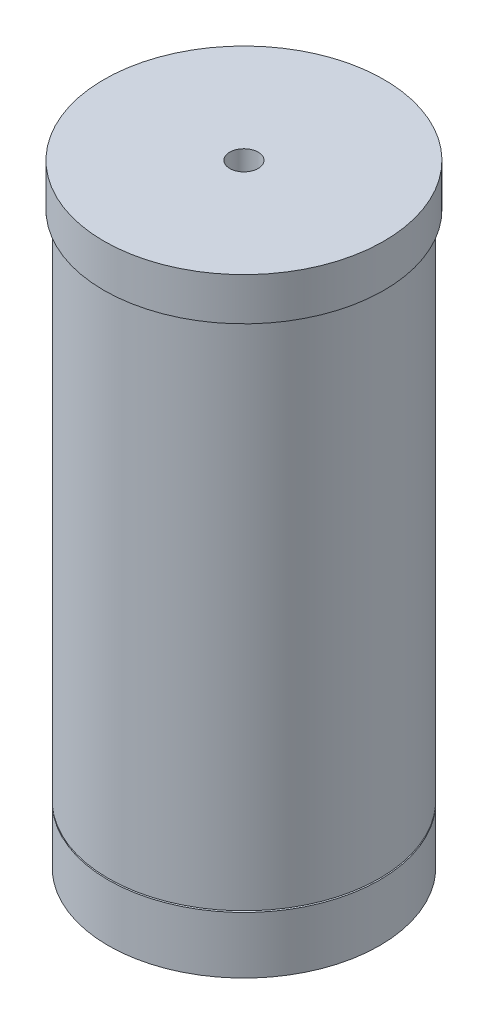
from build123d import *

# Parameters (mm, degrees)
SKETCH1_R             = 47.75
SKETCH1_R_2           = 11.5
SKETCH1_R_3           = 5
SKETCH1_R_4           = 8.5
SKETCH1_R_5           = 6
BOSS_EXTRUDE1_DEPTH   = 45
SKETCH1_3_R           = 11.5
SKETCH1_3_R_2         = 8.5
CUT_EXTRUDE1_DEPTH    = 5
SKETCH3_R             = 47.75
SKETCH3_R_2           = 5
BOSS_EXTRUDE2_DEPTH   = 10
BOSS_EXTRUDE6_DEPTH   = 125
SKETCH6_R             = 47.75
SKETCH6_R_2           = 42.5
BOSS_EXTRUDE6_2_DEPTH = 125
BOSS_EXTRUDE7_DEPTH   = 20
SKETCH7_R             = 11.25
SKETCH7_R_2           = 8.75
BOSS_EXTRUDE8_DEPTH   = 2
BOSS_EXTRUDE8_2_DEPTH = 2
BOSS_EXTRUDE8_3_DEPTH = 2
BOSS_EXTRUDE8_4_DEPTH = 2
BOSS_EXTRUDE8_5_DEPTH = 2
BOSS_EXTRUDE8_6_DEPTH = 2
BOSS_EXTRUDE9_START   = -20
SKETCH7_4_R           = 47.75
BOSS_EXTRUDE9_DEPTH   = 20
SKETCH8_R             = 49.28
SKETCH8_R_2           = 5
BOSS_EXTRUDE10_DEPTH  = 15
BOSS_EXTRUDE11_START  = -25
SKETCH8_4_R           = 5
BOSS_EXTRUDE11_DEPTH  = 25


with BuildPart() as part:
    # Sketch1 → Boss-Extrude1 (new body)
    # profile 1 of 13: a face of its own
    with BuildSketch(Plane(origin=(0, 0, 0), x_dir=(1, 0, 0), z_dir=(0, 1, 0))):
        Circle(SKETCH1_R)
        with Locations((-31.875552268, -8.541028488)):
            Circle(SKETCH1_R_2, mode=Mode.SUBTRACT)
        with Locations((-8.541028488, -31.875552268)):
            Circle(SKETCH1_R_2, mode=Mode.SUBTRACT)
        with Locations((23.334523779, -23.334523779)):
            Circle(SKETCH1_R_2, mode=Mode.SUBTRACT)
        with Locations((31.875552268, 8.541028488)):
            Circle(SKETCH1_R_2, mode=Mode.SUBTRACT)
        with Locations((8.541028488, 31.875552268)):
            Circle(SKETCH1_R_2, mode=Mode.SUBTRACT)
        with Locations((-23.334523779, 23.334523779)):
            Circle(SKETCH1_R_2, mode=Mode.SUBTRACT)
        Circle(SKETCH1_R_3, mode=Mode.SUBTRACT)
    # profile 2 of 13: a face of its own
    with BuildSketch(Plane(origin=(0, 0, 0), x_dir=(1, 0, 0), z_dir=(0, 1, 0))):
        with Locations((23.334523779, -23.334523779)):
            Circle(SKETCH1_R_2)
        with Locations((23.334523779, -23.334523779)):
            Circle(SKETCH1_R_4, mode=Mode.SUBTRACT)
    # profile 3 of 13: a face of its own
    with BuildSketch(Plane(origin=(0, 0, 0), x_dir=(1, 0, 0), z_dir=(0, 1, 0))):
        with Locations((23.334523779, -23.334523779)):
            Circle(SKETCH1_R_4)
        with Locations((23.334523779, -23.334523779)):
            Circle(SKETCH1_R_5, mode=Mode.SUBTRACT)
    # profile 4 of 13: a face of its own
    with BuildSketch(Plane(origin=(0, 0, 0), x_dir=(1, 0, 0), z_dir=(0, 1, 0))):
        with Locations((31.875552268, 8.541028488)):
            Circle(SKETCH1_R_2)
        with Locations((31.875552268, 8.541028488)):
            Circle(SKETCH1_R_4, mode=Mode.SUBTRACT)
    # profile 5 of 13: a face of its own
    with BuildSketch(Plane(origin=(0, 0, 0), x_dir=(1, 0, 0), z_dir=(0, 1, 0))):
        with Locations((31.875552268, 8.541028488)):
            Circle(SKETCH1_R_4)
        with Locations((31.875552268, 8.541028488)):
            Circle(SKETCH1_R_5, mode=Mode.SUBTRACT)
    # profile 6 of 13: a face of its own
    with BuildSketch(Plane(origin=(0, 0, 0), x_dir=(1, 0, 0), z_dir=(0, 1, 0))):
        with Locations((-8.541028488, -31.875552268)):
            Circle(SKETCH1_R_2)
        with Locations((-8.541028488, -31.875552268)):
            Circle(SKETCH1_R_4, mode=Mode.SUBTRACT)
    # profile 7 of 13: a face of its own
    with BuildSketch(Plane(origin=(0, 0, 0), x_dir=(1, 0, 0), z_dir=(0, 1, 0))):
        with Locations((-8.541028488, -31.875552268)):
            Circle(SKETCH1_R_4)
        with Locations((-8.541028488, -31.875552268)):
            Circle(SKETCH1_R_5, mode=Mode.SUBTRACT)
    # profile 8 of 13: a face of its own
    with BuildSketch(Plane(origin=(0, 0, 0), x_dir=(1, 0, 0), z_dir=(0, 1, 0))):
        with Locations((-31.875552268, -8.541028488)):
            Circle(SKETCH1_R_2)
        with Locations((-31.875552268, -8.541028488)):
            Circle(SKETCH1_R_4, mode=Mode.SUBTRACT)
    # profile 9 of 13: a face of its own
    with BuildSketch(Plane(origin=(0, 0, 0), x_dir=(1, 0, 0), z_dir=(0, 1, 0))):
        with Locations((-31.875552268, -8.541028488)):
            Circle(SKETCH1_R_4)
        with Locations((-31.875552268, -8.541028488)):
            Circle(SKETCH1_R_5, mode=Mode.SUBTRACT)
    # profile 10 of 13: a face of its own
    with BuildSketch(Plane(origin=(0, 0, 0), x_dir=(1, 0, 0), z_dir=(0, 1, 0))):
        with Locations((-23.334523779, 23.334523779)):
            Circle(SKETCH1_R_2)
        with Locations((-23.334523779, 23.334523779)):
            Circle(SKETCH1_R_4, mode=Mode.SUBTRACT)
    # profile 11 of 13: a face of its own
    with BuildSketch(Plane(origin=(0, 0, 0), x_dir=(1, 0, 0), z_dir=(0, 1, 0))):
        with Locations((-23.334523779, 23.334523779)):
            Circle(SKETCH1_R_4)
        with Locations((-23.334523779, 23.334523779)):
            Circle(SKETCH1_R_5, mode=Mode.SUBTRACT)
    # profile 12 of 13: a face of its own
    with BuildSketch(Plane(origin=(0, 0, 0), x_dir=(1, 0, 0), z_dir=(0, 1, 0))):
        with Locations((8.541028488, 31.875552268)):
            Circle(SKETCH1_R_2)
        with Locations((8.541028488, 31.875552268)):
            Circle(SKETCH1_R_4, mode=Mode.SUBTRACT)
    # profile 13 of 13: a face of its own
    with BuildSketch(Plane(origin=(0, 0, 0), x_dir=(1, 0, 0), z_dir=(0, 1, 0))):
        with Locations((8.541028488, 31.875552268)):
            Circle(SKETCH1_R_4)
        with Locations((8.541028488, 31.875552268)):
            Circle(SKETCH1_R_5, mode=Mode.SUBTRACT)
    extrude(amount=BOSS_EXTRUDE1_DEPTH)

    # Sketch1<3> → Cut-Extrude1 (cut)
    # profile 1 of 6: a face of its own
    with BuildSketch(Plane(origin=(0, 0, 0), x_dir=(1, 0, 0), z_dir=(0, 1, 0))):
        with Locations((-8.541028488, -31.875552268)):
            Circle(SKETCH1_3_R)
        with Locations((-8.541028488, -31.875552268)):
            Circle(SKETCH1_3_R_2, mode=Mode.SUBTRACT)
    # profile 2 of 6: a face of its own
    with BuildSketch(Plane(origin=(0, 0, 0), x_dir=(1, 0, 0), z_dir=(0, 1, 0))):
        with Locations((-31.875552268, -8.541028488)):
            Circle(SKETCH1_3_R)
        with Locations((-31.875552268, -8.541028488)):
            Circle(SKETCH1_3_R_2, mode=Mode.SUBTRACT)
    # profile 3 of 6: a face of its own
    with BuildSketch(Plane(origin=(0, 0, 0), x_dir=(1, 0, 0), z_dir=(0, 1, 0))):
        with Locations((-23.334523779, 23.334523779)):
            Circle(SKETCH1_3_R)
        with Locations((-23.334523779, 23.334523779)):
            Circle(SKETCH1_3_R_2, mode=Mode.SUBTRACT)
    # profile 4 of 6: a face of its own
    with BuildSketch(Plane(origin=(0, 0, 0), x_dir=(1, 0, 0), z_dir=(0, 1, 0))):
        with Locations((8.541028488, 31.875552268)):
            Circle(SKETCH1_3_R)
        with Locations((8.541028488, 31.875552268)):
            Circle(SKETCH1_3_R_2, mode=Mode.SUBTRACT)
    # profile 5 of 6: a face of its own
    with BuildSketch(Plane(origin=(0, 0, 0), x_dir=(1, 0, 0), z_dir=(0, 1, 0))):
        with Locations((31.875552268, 8.541028488)):
            Circle(SKETCH1_3_R)
        with Locations((31.875552268, 8.541028488)):
            Circle(SKETCH1_3_R_2, mode=Mode.SUBTRACT)
    # profile 6 of 6: a face of its own
    with BuildSketch(Plane(origin=(0, 0, 0), x_dir=(1, 0, 0), z_dir=(0, 1, 0))):
        with Locations((23.334523779, -23.334523779)):
            Circle(SKETCH1_3_R)
        with Locations((23.334523779, -23.334523779)):
            Circle(SKETCH1_3_R_2, mode=Mode.SUBTRACT)
    extrude(amount=CUT_EXTRUDE1_DEPTH, mode=Mode.SUBTRACT)

    # Sketch3 → Boss-Extrude2 (add)
    with BuildSketch(Plane(origin=(0, 45, 0), x_dir=(1, 0, 0), z_dir=(0, 1, 0))):
        Circle(SKETCH3_R)
        Circle(SKETCH3_R_2, mode=Mode.SUBTRACT)
    extrude(amount=BOSS_EXTRUDE2_DEPTH)


with BuildPart() as body_2:
    # Sketch6 → Boss-Extrude6 (new body)
    with BuildSketch(Plane(origin=(0, 55, 0), x_dir=(1, 0, 0), z_dir=(0, 1, 0))):
        with BuildLine():
            ThreePointArc((15, 39.497626511), (0, 42.25), (-15, 39.497626511))
            Line((-15, 39.497626511), (-15, -39.497626511))
            ThreePointArc((-15, -39.497626511), (0, -42.25), (15, -39.497626511))
            Line((15, -39.497626511), (15, 39.497626511))
        make_face()
        with BuildLine():
            Line((-10, -34.497626511), (-10, 34.497626511))
            ThreePointArc((-10, 34.497626511), (0, 35.917770461), (10, 34.497626511))
            Line((10, 34.497626511), (10, -34.497626511))
            ThreePointArc((10, -34.497626511), (0, -35.917770461), (-10, -34.497626511))
        make_face(mode=Mode.SUBTRACT)
    extrude(amount=BOSS_EXTRUDE6_DEPTH)


with BuildPart() as body_3:
    # Sketch6 → Boss-Extrude6 2 (new body)
    with BuildSketch(Plane(origin=(0, 55, 0), x_dir=(1, 0, 0), z_dir=(0, 1, 0))):
        Circle(SKETCH6_R)
        Circle(SKETCH6_R_2, mode=Mode.SUBTRACT)
    extrude(amount=BOSS_EXTRUDE6_2_DEPTH)


with BuildPart() as body_4:
    # Sketch6<4> → Boss-Extrude7 (new body)
    with BuildSketch(Plane(origin=(0, 55, 0), x_dir=(1, 0, 0), z_dir=(0, 1, 0))):
        with BuildLine():
            ThreePointArc((9.5, 33.997626511), (0, 35.299980289), (-9.5, 33.997626511))
            Line((-9.5, 33.997626511), (-9.5, -33.997626511))
            ThreePointArc((-9.5, -33.997626511), (0, -35.299980289), (9.5, -33.997626511))
            Line((9.5, -33.997626511), (9.5, 33.997626511))
        make_face()
        with BuildLine():
            Line((-5.5, -30.812964253), (-5.5, 30.812964253))
            ThreePointArc((-5.5, 30.812964253), (0, 31.299980289), (5.5, 30.812964253))
            Line((5.5, 30.812964253), (5.5, -30.812964253))
            ThreePointArc((5.5, -30.812964253), (0, -31.299980289), (-5.5, -30.812964253))
        make_face(mode=Mode.SUBTRACT)
    extrude(amount=BOSS_EXTRUDE7_DEPTH)


with BuildPart() as body_5:
    # Sketch7 → Boss-Extrude8 (new body)
    with BuildSketch(Plane(origin=(0, -0.5, 0), x_dir=(1, 0, 0), z_dir=(0, 1, 0))):
        with Locations((-8.541028488, -31.875552268)):
            Circle(SKETCH7_R)
        with Locations((-8.541028488, -31.875552268)):
            Circle(SKETCH7_R_2, mode=Mode.SUBTRACT)
    extrude(amount=BOSS_EXTRUDE8_DEPTH)

    # Sketch7<4> → Boss-Extrude9 (add)
    with BuildSketch(Plane(origin=(0, -0.5, 0), x_dir=(1, 0, 0), z_dir=(0, 1, 0)).offset(BOSS_EXTRUDE9_START)):
        Circle(SKETCH7_4_R)
    extrude(amount=BOSS_EXTRUDE9_DEPTH)


with BuildPart() as body_6:
    # Sketch7 → Boss-Extrude8 2 (new body)
    with BuildSketch(Plane(origin=(0, -0.5, 0), x_dir=(1, 0, 0), z_dir=(0, 1, 0))):
        with Locations((-31.875552268, -8.541028488)):
            Circle(SKETCH7_R)
        with Locations((-31.875552268, -8.541028488)):
            Circle(SKETCH7_R_2, mode=Mode.SUBTRACT)
    extrude(amount=BOSS_EXTRUDE8_2_DEPTH)


with BuildPart() as body_7:
    # Sketch7 → Boss-Extrude8 3 (new body)
    with BuildSketch(Plane(origin=(0, -0.5, 0), x_dir=(1, 0, 0), z_dir=(0, 1, 0))):
        with Locations((-23.334523779, 23.334523779)):
            Circle(SKETCH7_R)
        with Locations((-23.334523779, 23.334523779)):
            Circle(SKETCH7_R_2, mode=Mode.SUBTRACT)
    extrude(amount=BOSS_EXTRUDE8_3_DEPTH)


with BuildPart() as body_8:
    # Sketch7 → Boss-Extrude8 4 (new body)
    with BuildSketch(Plane(origin=(0, -0.5, 0), x_dir=(1, 0, 0), z_dir=(0, 1, 0))):
        with Locations((23.334523779, -23.334523779)):
            Circle(SKETCH7_R)
        with Locations((23.334523779, -23.334523779)):
            Circle(SKETCH7_R_2, mode=Mode.SUBTRACT)
    extrude(amount=BOSS_EXTRUDE8_4_DEPTH)


with BuildPart() as body_9:
    # Sketch7 → Boss-Extrude8 5 (new body)
    with BuildSketch(Plane(origin=(0, -0.5, 0), x_dir=(1, 0, 0), z_dir=(0, 1, 0))):
        with Locations((8.541028488, 31.875552268)):
            Circle(SKETCH7_R)
        with Locations((8.541028488, 31.875552268)):
            Circle(SKETCH7_R_2, mode=Mode.SUBTRACT)
    extrude(amount=BOSS_EXTRUDE8_5_DEPTH)


with BuildPart() as body_10:
    # Sketch7 → Boss-Extrude8 6 (new body)
    with BuildSketch(Plane(origin=(0, -0.5, 0), x_dir=(1, 0, 0), z_dir=(0, 1, 0))):
        with Locations((31.875552268, 8.541028488)):
            Circle(SKETCH7_R)
        with Locations((31.875552268, 8.541028488)):
            Circle(SKETCH7_R_2, mode=Mode.SUBTRACT)
    extrude(amount=BOSS_EXTRUDE8_6_DEPTH)


with BuildPart() as body_11:
    # Sketch8 → Boss-Extrude10 (new body)
    with BuildSketch(Plane(origin=(0, 180, 0), x_dir=(1, 0, 0), z_dir=(0, 1, 0))):
        Circle(SKETCH8_R)
        Circle(SKETCH8_R_2, mode=Mode.SUBTRACT)
    extrude(amount=BOSS_EXTRUDE10_DEPTH)

    # Sketch8<4> → Boss-Extrude11 (add)
    with BuildSketch(Plane(origin=(0, 180, 0), x_dir=(1, 0, 0), z_dir=(0, 1, 0)).offset(BOSS_EXTRUDE11_START)):
        with BuildLine():
            ThreePointArc((9.5, 33.997626511), (0, 35.299980289), (-9.5, 33.997626511))
            Line((-9.5, 33.997626511), (-9.5, -33.997626511))
            ThreePointArc((-9.5, -33.997626511), (0, -35.299980289), (9.5, -33.997626511))
            Line((9.5, -33.997626511), (9.5, 33.997626511))
        make_face()
        Circle(SKETCH8_4_R, mode=Mode.SUBTRACT)
    extrude(amount=BOSS_EXTRUDE11_DEPTH)


with BuildPart() as body_9_1:
    add(body_9.part)

    # Combine1: union body 8, body 10, body 6, body 5, body 7
    add(body_8.part)
    add(body_10.part)
    add(body_6.part)
    add(body_5.part)
    add(body_7.part)


with BuildPart() as part_1:
    add(part.part)

    # Combine2: union body 3, body 4
    add(body_3.part)
    add(body_4.part)


solid = Compound([body_2.part, body_11.part, body_9_1.part, part_1.part])
